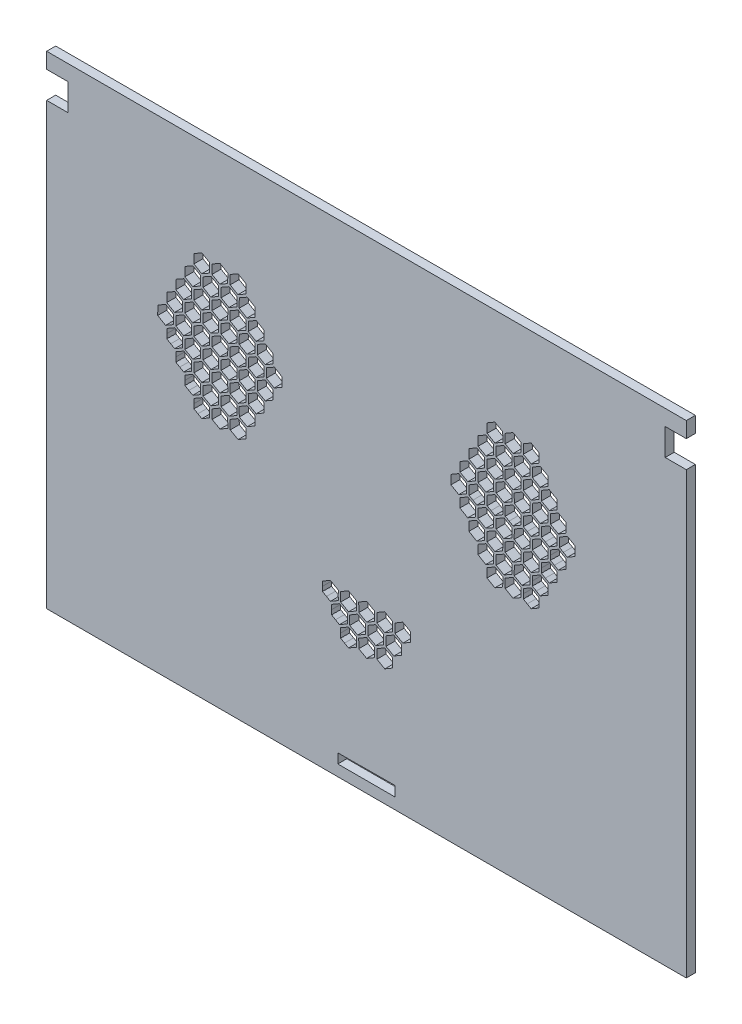
from build123d import *

# Parameters (mm, degrees)
BOSS_EXTRUDE1_DEPTH = 3


with BuildPart() as part:
    # Sketch1 → Boss-Extrude1 (new body)
    with BuildSketch(Plane.XY):
        Polygon((106, 80), (-106, 80), (-106, 74.8), (-99, 74.8), (-99, 65.9), (-106, 65.9), (-106, -80), (106, -80), (106, 65.9), (99, 65.9), (99, 74.8), (106, 74.8), align=None)
        Polygon((-3.358406193, -38.245892144), (-3.346192794, -39.72437967), (-3.370738906, -39.738823029), (-3.370974165, -39.767302264), (-4.657488621, -40.495968913), (-5.931789678, -41.24578979), (-5.956571049, -41.231753913), (-5.981352421, -41.24578979), (-7.255653477, -40.495968913), (-8.542167934, -39.767302264), (-8.542403193, -39.738823029), (-8.566949305, -39.72437967), (-8.554735905, -38.245892144), (-8.566949305, -36.767404619), (-8.542403193, -36.75296126), (-8.542167934, -36.724482025), (-7.255653477, -35.995815376), (-5.981352421, -35.245994499), (-5.956571049, -35.260030376), (-5.931789678, -35.245994499), (-4.657488621, -35.995815376), (-3.370974165, -36.724482025), (-3.370738906, -36.75296126), (-3.346192794, -36.767404619), align=None, mode=Mode.SUBTRACT)
        Polygon((-6.358406193, -33.049739722), (-6.346192794, -34.528227247), (-6.370738906, -34.542670606), (-6.370974165, -34.571149841), (-7.657488621, -35.29981649), (-8.931789678, -36.049637367), (-8.956571049, -36.03560149), (-8.981352421, -36.049637367), (-10.255653477, -35.29981649), (-11.542167934, -34.571149841), (-11.542403193, -34.542670606), (-11.566949305, -34.528227247), (-11.554735905, -33.049739722), (-11.566949305, -31.571252196), (-11.542403193, -31.556808837), (-11.542167934, -31.528329602), (-10.255653477, -30.799662953), (-8.981352421, -30.049842076), (-8.956571049, -30.063877953), (-8.931789678, -30.049842076), (-7.657488621, -30.799662953), (-6.370974165, -31.528329602), (-6.370738906, -31.556808837), (-6.346192794, -31.571252196), align=None, mode=Mode.SUBTRACT)
        Polygon((-2.981352421, -30.049842076), (-0.370974165, -31.528329602), (-0.346192794, -34.528227247), (-2.931789678, -36.049637367), (-5.542167934, -34.571149841), (-5.566949305, -31.571252196), align=None, mode=Mode.SUBTRACT)
        Polygon((-9.358406193, -27.853587299), (-9.346192794, -29.332074825), (-9.370738906, -29.346518183), (-9.370974165, -29.374997419), (-10.657488621, -30.103664067), (-11.931789678, -30.853484944), (-11.956571049, -30.839449067), (-11.981352421, -30.853484944), (-13.255653477, -30.103664067), (-14.542167934, -29.374997419), (-14.542403193, -29.346518183), (-14.566949305, -29.332074825), (-14.554735905, -27.853587299), (-14.566949305, -26.375099773), (-14.542403193, -26.360656415), (-14.542167934, -26.332177179), (-13.255653477, -25.60351053), (-11.981352421, -24.853689653), (-11.956571049, -24.86772553), (-11.931789678, -24.853689653), (-10.657488621, -25.60351053), (-9.370974165, -26.332177179), (-9.370738906, -26.360656415), (-9.346192794, -26.375099773), align=None, mode=Mode.SUBTRACT)
        Polygon((-3.346192794, -29.332074825), (-5.931789678, -30.853484944), (-8.542167934, -29.374997419), (-8.566949305, -26.375099773), (-5.981352421, -24.853689653), (-3.370974165, -26.332177179), align=None, mode=Mode.SUBTRACT)
        Polygon((-9.5, -73.116618176), (9.5, -73), (9.5, -76.316618176), (-9.5, -76.316618176), align=None, mode=Mode.SUBTRACT)
        Polygon((-2.566949305, -36.767404619), (0, -35.256967058), (0.018647579, -35.245994499), (2.629025835, -36.724482025), (2.653807206, -39.72437967), (0.068210322, -41.24578979), (0, -41.207156266), (-2.542167934, -39.767302264), align=None, mode=Mode.SUBTRACT)
        Polygon((6.018647579, -35.245994499), (8.629025835, -36.724482025), (8.653807206, -39.72437967), (6.068210322, -41.24578979), (3.457832066, -39.767302264), (3.433050695, -36.767404619), align=None, mode=Mode.SUBTRACT)
        Polygon((3.018647579, -30.049842076), (5.629025835, -31.528329602), (5.653807206, -34.528227247), (3.068210322, -36.049637367), (0.457832066, -34.571149841), (0.433050695, -31.571252196), align=None, mode=Mode.SUBTRACT)
        Polygon((9.018647579, -30.049842076), (11.629025835, -31.528329602), (11.653807206, -34.528227247), (9.068210322, -36.049637367), (6.457832066, -34.571149841), (6.433050695, -31.571252196), align=None, mode=Mode.SUBTRACT)
        Polygon((0.068210322, -30.853484944), (0, -30.814851421), (-2.542167934, -29.374997419), (-2.566949305, -26.375099773), (0, -24.864662213), (0.018647579, -24.853689653), (2.629025835, -26.332177179), (2.653807206, -29.332074825), align=None, mode=Mode.SUBTRACT)
        Polygon((8.653807206, -29.332074825), (6.068210322, -30.853484944), (3.457832066, -29.374997419), (3.433050695, -26.375099773), (6.018647579, -24.853689653), (8.629025835, -26.332177179), align=None, mode=Mode.SUBTRACT)
        Polygon((14.653807206, -29.332074825), (12.068210322, -30.853484944), (9.457832066, -29.374997419), (9.433050695, -26.375099773), (12.018647579, -24.853689653), (14.629025835, -26.332177179), align=None, mode=Mode.SUBTRACT)
        Polygon((-51.974746469, 3.264817356), (-51.962533069, 1.78632983), (-51.987079181, 1.771886472), (-51.987314441, 1.743407236), (-53.273828897, 1.014740588), (-54.548129954, 0.264919711), (-54.572911325, 0.278955588), (-54.597692696, 0.264919711), (-55.871993753, 1.014740588), (-57.158508209, 1.743407236), (-57.158743468, 1.771886472), (-57.18328958, 1.78632983), (-57.171076181, 3.264817356), (-57.18328958, 4.743304882), (-57.158743468, 4.75774824), (-57.158508209, 4.786227476), (-55.871993753, 5.514894125), (-54.597692696, 6.264715002), (-54.572911325, 6.250679125), (-54.548129954, 6.264715002), (-53.273828897, 5.514894125), (-51.987314441, 4.786227476), (-51.987079181, 4.75774824), (-51.962533069, 4.743304882), align=None, mode=Mode.SUBTRACT)
        Polygon((-54.974746469, 8.460969779), (-54.962533069, 6.982482253), (-54.987079181, 6.968038895), (-54.987314441, 6.939559659), (-56.273828897, 6.21089301), (-57.548129954, 5.461072133), (-57.572911325, 5.47510801), (-57.597692696, 5.461072133), (-58.871993753, 6.21089301), (-60.158508209, 6.939559659), (-60.158743468, 6.968038895), (-60.18328958, 6.982482253), (-60.171076181, 8.460969779), (-60.18328958, 9.939457305), (-60.158743468, 9.953900663), (-60.158508209, 9.982379899), (-58.871993753, 10.711046547), (-57.597692696, 11.460867424), (-57.572911325, 11.446831547), (-57.548129954, 11.460867424), (-56.273828897, 10.711046547), (-54.987314441, 9.982379899), (-54.987079181, 9.953900663), (-54.962533069, 9.939457305), align=None, mode=Mode.SUBTRACT)
        Polygon((-57.974746469, 13.657122201), (-57.962533069, 12.178634676), (-57.987079181, 12.164191317), (-57.987314441, 12.135712082), (-59.273828897, 11.407045433), (-60.548129954, 10.657224556), (-60.572911325, 10.671260433), (-60.597692696, 10.657224556), (-61.871993753, 11.407045433), (-63.158508209, 12.135712082), (-63.158743468, 12.164191317), (-63.18328958, 12.178634676), (-63.171076181, 13.657122201), (-63.18328958, 15.135609727), (-63.158743468, 15.150053086), (-63.158508209, 15.178532321), (-61.871993753, 15.90719897), (-60.597692696, 16.657019847), (-60.572911325, 16.64298397), (-60.548129954, 16.657019847), (-59.273828897, 15.90719897), (-57.987314441, 15.178532321), (-57.987079181, 15.150053086), (-57.962533069, 15.135609727), align=None, mode=Mode.SUBTRACT)
        Polygon((-51.962533069, 12.178634676), (-54.548129954, 10.657224556), (-57.158508209, 12.135712082), (-57.18328958, 15.135609727), (-54.597692696, 16.657019847), (-51.987314441, 15.178532321), align=None, mode=Mode.SUBTRACT)
        Polygon((-48.597692696, 6.264715002), (-45.987314441, 4.786227476), (-45.962533069, 1.78632983), (-48.548129954, 0.264919711), (-51.158508209, 1.743407236), (-51.18328958, 4.743304882), align=None, mode=Mode.SUBTRACT)
        Polygon((-51.597692696, 11.460867424), (-48.987314441, 9.982379899), (-48.962533069, 6.982482253), (-51.548129954, 5.461072133), (-54.158508209, 6.939559659), (-54.18328958, 9.939457305), align=None, mode=Mode.SUBTRACT)
        Polygon((-45.597692696, 11.460867424), (-42.987314441, 9.982379899), (-42.962533069, 6.982482253), (-45.548129954, 5.461072133), (-48.158508209, 6.939559659), (-48.18328958, 9.939457305), align=None, mode=Mode.SUBTRACT)
        Polygon((-42.597692696, 6.264715002), (-39.987314441, 4.786227476), (-39.962533069, 1.78632983), (-42.548129954, 0.264919711), (-45.158508209, 1.743407236), (-45.18328958, 4.743304882), align=None, mode=Mode.SUBTRACT)
        Polygon((-39.597692696, 11.460867424), (-36.987314441, 9.982379899), (-36.962533069, 6.982482253), (-39.548129954, 5.461072133), (-42.158508209, 6.939559659), (-42.18328958, 9.939457305), align=None, mode=Mode.SUBTRACT)
        Polygon((-45.962533069, 12.178634676), (-48.548129954, 10.657224556), (-51.158508209, 12.135712082), (-51.18328958, 15.135609727), (-48.597692696, 16.657019847), (-45.987314441, 15.178532321), align=None, mode=Mode.SUBTRACT)
        Polygon((-39.962533069, 12.178634676), (-42.548129954, 10.657224556), (-45.158508209, 12.135712082), (-45.18328958, 15.135609727), (-42.597692696, 16.657019847), (-39.987314441, 15.178532321), align=None, mode=Mode.SUBTRACT)
        Polygon((-33.962533069, 12.178634676), (-36.548129954, 10.657224556), (-39.158508209, 12.135712082), (-39.18328958, 15.135609727), (-36.597692696, 16.657019847), (-33.987314441, 15.178532321), align=None, mode=Mode.SUBTRACT)
        Polygon((-60.974746469, 18.853274624), (-60.962533069, 17.374787098), (-60.987079181, 17.36034374), (-60.987314441, 17.331864504), (-62.273828897, 16.603197856), (-63.548129954, 15.853376979), (-63.572911325, 15.867412856), (-63.597692696, 15.853376979), (-64.871993753, 16.603197856), (-66.158508209, 17.331864504), (-66.158743468, 17.36034374), (-66.18328958, 17.374787098), (-66.171076181, 18.853274624), (-66.18328958, 20.33176215), (-66.158743468, 20.346205508), (-66.158508209, 20.374684744), (-64.871993753, 21.103351393), (-63.597692696, 21.85317227), (-63.572911325, 21.839136393), (-63.548129954, 21.85317227), (-62.273828897, 21.103351393), (-60.987314441, 20.374684744), (-60.987079181, 20.346205508), (-60.962533069, 20.33176215), align=None, mode=Mode.SUBTRACT)
        Polygon((-66.597692696, 21.049529401), (-67.871993753, 21.799350278), (-69.18328958, 22.570939521), (-69.158508209, 25.570837167), (-66.548129954, 27.049324692), (-63.962533069, 25.527914573), (-63.987079181, 22.556496163), (-63.987314441, 22.528016927), (-65.273828897, 21.799350278), (-66.548129954, 21.049529401), (-66.572911325, 21.063565278), align=None, mode=Mode.SUBTRACT)
        Polygon((-59.273828897, 21.799350278), (-60.548129954, 21.049529401), (-60.572911325, 21.063565278), (-60.597692696, 21.049529401), (-61.871993753, 21.799350278), (-63.18328958, 22.570939521), (-63.158508209, 25.570837167), (-60.548129954, 27.049324692), (-57.962533069, 25.527914573), (-57.987079181, 22.556496163), (-57.987314441, 22.528016927), align=None, mode=Mode.SUBTRACT)
        Polygon((-60.18328958, 20.33176215), (-57.597692696, 21.85317227), (-54.987314441, 20.374684744), (-54.962533069, 17.374787098), (-57.548129954, 15.853376979), (-60.158508209, 17.331864504), align=None, mode=Mode.SUBTRACT)
        Polygon((-53.273828897, 21.799350278), (-54.548129954, 21.049529401), (-54.572911325, 21.063565278), (-54.597692696, 21.049529401), (-55.871993753, 21.799350278), (-57.18328958, 22.570939521), (-57.158508209, 25.570837167), (-54.548129954, 27.049324692), (-51.962533069, 25.527914573), (-51.987079181, 22.556496163), (-51.987314441, 22.528016927), align=None, mode=Mode.SUBTRACT)
        Polygon((-60.962533069, 30.724066995), (-60.987314441, 27.72416935), (-63.597692696, 26.245681824), (-66.18328958, 27.767091944), (-66.158508209, 30.766989589), (-63.548129954, 32.245477115), align=None, mode=Mode.SUBTRACT)
        Polygon((-57.597692696, 26.245681824), (-60.18328958, 27.767091944), (-60.158508209, 30.766989589), (-57.548129954, 32.245477115), (-54.962533069, 30.724066995), (-54.987314441, 27.72416935), align=None, mode=Mode.SUBTRACT)
        Polygon((-54.18328958, 20.33176215), (-51.597692696, 21.85317227), (-48.987314441, 20.374684744), (-48.962533069, 17.374787098), (-51.548129954, 15.853376979), (-54.158508209, 17.331864504), align=None, mode=Mode.SUBTRACT)
        Polygon((-48.18328958, 20.33176215), (-45.597692696, 21.85317227), (-42.987314441, 20.374684744), (-42.962533069, 17.374787098), (-45.548129954, 15.853376979), (-48.158508209, 17.331864504), align=None, mode=Mode.SUBTRACT)
        Polygon((-45.962533069, 25.527914573), (-45.974746469, 24.049427047), (-45.987079181, 22.556496163), (-45.987314441, 22.528016927), (-47.273828897, 21.799350278), (-48.548129954, 21.049529401), (-48.572911325, 21.063565278), (-48.597692696, 21.049529401), (-49.871993753, 21.799350278), (-51.18328958, 22.570939521), (-51.158508209, 25.570837167), (-48.548129954, 27.049324692), align=None, mode=Mode.SUBTRACT)
        Polygon((-42.18328958, 20.33176215), (-39.597692696, 21.85317227), (-36.987314441, 20.374684744), (-36.962533069, 17.374787098), (-39.548129954, 15.853376979), (-42.158508209, 17.331864504), align=None, mode=Mode.SUBTRACT)
        Polygon((-39.962533069, 25.527914573), (-39.974746469, 24.049427047), (-39.987079181, 22.556496163), (-39.987314441, 22.528016927), (-41.273828897, 21.799350278), (-42.548129954, 21.049529401), (-42.572911325, 21.063565278), (-42.597692696, 21.049529401), (-43.871993753, 21.799350278), (-45.18328958, 22.570939521), (-45.171076181, 24.049427047), (-45.158508209, 25.570837167), (-42.548129954, 27.049324692), align=None, mode=Mode.SUBTRACT)
        Polygon((-33.962533069, 25.527914573), (-33.974746469, 24.049427047), (-33.987079181, 22.556496163), (-33.987314441, 22.528016927), (-35.273828897, 21.799350278), (-36.548129954, 21.049529401), (-36.572911325, 21.063565278), (-36.597692696, 21.049529401), (-37.871993753, 21.799350278), (-39.18328958, 22.570939521), (-39.171076181, 24.049427047), (-39.158508209, 25.570837167), (-36.548129954, 27.049324692), align=None, mode=Mode.SUBTRACT)
        Polygon((-51.597692696, 26.245681824), (-54.18328958, 27.767091944), (-54.158508209, 30.766989589), (-51.548129954, 32.245477115), (-48.962533069, 30.724066995), (-48.987314441, 27.72416935), align=None, mode=Mode.SUBTRACT)
        Polygon((-45.597692696, 26.245681824), (-48.18328958, 27.767091944), (-48.158508209, 30.766989589), (-45.548129954, 32.245477115), (-42.962533069, 30.724066995), (-42.987314441, 27.72416935), align=None, mode=Mode.SUBTRACT)
        Polygon((-39.597692696, 26.245681824), (-42.18328958, 27.767091944), (-42.158508209, 30.766989589), (-39.548129954, 32.245477115), (-36.962533069, 30.724066995), (-36.987314441, 27.72416935), align=None, mode=Mode.SUBTRACT)
        Polygon((-57.962533069, 35.920219418), (-57.987314441, 32.920321773), (-60.597692696, 31.441834247), (-63.18328958, 32.963244367), (-63.158508209, 35.963142012), (-60.548129954, 37.441629538), align=None, mode=Mode.SUBTRACT)
        Polygon((-57.18328958, 32.963244367), (-57.158508209, 35.963142012), (-54.548129954, 37.441629538), (-51.962533069, 35.920219418), (-51.987314441, 32.920321773), (-54.597692696, 31.441834247), align=None, mode=Mode.SUBTRACT)
        Polygon((-54.962533069, 41.116371841), (-54.987314441, 38.116474195), (-57.597692696, 36.637986669), (-60.18328958, 38.159396789), (-60.158508209, 41.159294435), (-57.548129954, 42.637781961), align=None, mode=Mode.SUBTRACT)
        Polygon((-51.962533069, 46.312524264), (-51.987314441, 43.312626618), (-54.597692696, 41.834139092), (-57.18328958, 43.355549212), (-57.158508209, 46.355446857), (-54.548129954, 47.833934383), align=None, mode=Mode.SUBTRACT)
        Polygon((-51.18328958, 32.963244367), (-51.158508209, 35.963142012), (-48.548129954, 37.441629538), (-45.962533069, 35.920219418), (-45.987314441, 32.920321773), (-48.597692696, 31.441834247), align=None, mode=Mode.SUBTRACT)
        Polygon((-48.987314441, 38.116474195), (-51.597692696, 36.637986669), (-54.18328958, 38.159396789), (-54.158508209, 41.159294435), (-51.548129954, 42.637781961), (-48.962533069, 41.116371841), align=None, mode=Mode.SUBTRACT)
        Polygon((-42.987314441, 38.116474195), (-45.597692696, 36.637986669), (-48.18328958, 38.159396789), (-48.158508209, 41.159294435), (-45.548129954, 42.637781961), (-42.962533069, 41.116371841), align=None, mode=Mode.SUBTRACT)
        Polygon((-45.18328958, 32.963244367), (-45.158508209, 35.963142012), (-42.548129954, 37.441629538), (-39.962533069, 35.920219418), (-39.987314441, 32.920321773), (-42.597692696, 31.441834247), align=None, mode=Mode.SUBTRACT)
        Polygon((-39.18328958, 32.963244367), (-39.158508209, 35.963142012), (-36.548129954, 37.441629538), (-33.962533069, 35.920219418), (-33.987314441, 32.920321773), (-36.597692696, 31.441834247), align=None, mode=Mode.SUBTRACT)
        Polygon((-36.987314441, 38.116474195), (-39.597692696, 36.637986669), (-42.18328958, 38.159396789), (-42.158508209, 41.159294435), (-39.548129954, 42.637781961), (-36.962533069, 41.116371841), align=None, mode=Mode.SUBTRACT)
        Polygon((-45.987314441, 43.312626618), (-48.597692696, 41.834139092), (-51.18328958, 43.355549212), (-51.158508209, 46.355446857), (-48.548129954, 47.833934383), (-45.962533069, 46.312524264), align=None, mode=Mode.SUBTRACT)
        Polygon((-39.987314441, 43.312626618), (-42.597692696, 41.834139092), (-45.18328958, 43.355549212), (-45.158508209, 46.355446857), (-42.548129954, 47.833934383), (-39.962533069, 46.312524264), align=None, mode=Mode.SUBTRACT)
        Polygon((-36.18328958, 20.33176215), (-33.597692696, 21.85317227), (-30.987314441, 20.374684744), (-30.962533069, 17.374787098), (-33.548129954, 15.853376979), (-36.158508209, 17.331864504), align=None, mode=Mode.SUBTRACT)
        Polygon((-27.962533069, 25.527914573), (-27.974746469, 24.049427047), (-27.987314441, 22.528016927), (-30.572911325, 21.063565278), (-30.597692696, 21.049529401), (-31.871993753, 21.799350278), (-33.18328958, 22.570939521), (-33.171076181, 24.049427047), (-33.158508209, 25.570837167), (-30.548129954, 27.049324692), align=None, mode=Mode.SUBTRACT)
        Polygon((-33.597692696, 26.245681824), (-36.18328958, 27.767091944), (-36.158508209, 30.766989589), (-33.548129954, 32.245477115), (-30.962533069, 30.724066995), (-30.987314441, 27.72416935), align=None, mode=Mode.SUBTRACT)
        Polygon((39.987314441, 4.786227476), (42.597692696, 6.264715002), (45.18328958, 4.743304882), (45.158508209, 1.743407236), (42.548129954, 0.264919711), (39.962533069, 1.78632983), align=None, mode=Mode.SUBTRACT)
        Polygon((36.987314441, 9.982379899), (39.597692696, 11.460867424), (42.18328958, 9.939457305), (42.158508209, 6.939559659), (39.548129954, 5.461072133), (36.962533069, 6.982482253), align=None, mode=Mode.SUBTRACT)
        Polygon((45.987314441, 4.786227476), (48.597692696, 6.264715002), (51.18328958, 4.743304882), (51.158508209, 1.743407236), (48.548129954, 0.264919711), (45.962533069, 1.78632983), align=None, mode=Mode.SUBTRACT)
        Polygon((42.987314441, 9.982379899), (45.597692696, 11.460867424), (48.18328958, 9.939457305), (48.158508209, 6.939559659), (45.548129954, 5.461072133), (42.962533069, 6.982482253), align=None, mode=Mode.SUBTRACT)
        Polygon((48.987314441, 9.982379899), (51.597692696, 11.460867424), (54.18328958, 9.939457305), (54.158508209, 6.939559659), (51.548129954, 5.461072133), (48.962533069, 6.982482253), align=None, mode=Mode.SUBTRACT)
        Polygon((39.18328958, 15.135609727), (39.158508209, 12.135712082), (36.548129954, 10.657224556), (33.962533069, 12.178634676), (33.987314441, 15.178532321), (36.597692696, 16.657019847), align=None, mode=Mode.SUBTRACT)
        Polygon((45.18328958, 15.135609727), (45.158508209, 12.135712082), (42.548129954, 10.657224556), (39.962533069, 12.178634676), (39.987314441, 15.178532321), (42.597692696, 16.657019847), align=None, mode=Mode.SUBTRACT)
        Polygon((51.18328958, 15.135609727), (51.158508209, 12.135712082), (48.548129954, 10.657224556), (45.962533069, 12.178634676), (45.987314441, 15.178532321), (48.597692696, 16.657019847), align=None, mode=Mode.SUBTRACT)
        Polygon((51.974746469, 3.264817356), (51.962533069, 4.743304882), (51.987079181, 4.75774824), (51.987314441, 4.786227476), (53.273828897, 5.514894125), (54.548129954, 6.264715002), (54.572911325, 6.250679125), (54.597692696, 6.264715002), (55.871993753, 5.514894125), (57.158508209, 4.786227476), (57.158743468, 4.75774824), (57.18328958, 4.743304882), (57.171076181, 3.264817356), (57.18328958, 1.78632983), (57.158743468, 1.771886472), (57.158508209, 1.743407236), (55.871993753, 1.014740588), (54.597692696, 0.264919711), (54.572911325, 0.278955588), (54.548129954, 0.264919711), (53.273828897, 1.014740588), (51.987314441, 1.743407236), (51.987079181, 1.771886472), (51.962533069, 1.78632983), align=None, mode=Mode.SUBTRACT)
        Polygon((54.974746469, 8.460969779), (54.962533069, 9.939457305), (54.987079181, 9.953900663), (54.987314441, 9.982379899), (56.273828897, 10.711046547), (57.548129954, 11.460867424), (57.572911325, 11.446831547), (57.597692696, 11.460867424), (58.871993753, 10.711046547), (60.158508209, 9.982379899), (60.158743468, 9.953900663), (60.18328958, 9.939457305), (60.171076181, 8.460969779), (60.18328958, 6.982482253), (60.158743468, 6.968038895), (60.158508209, 6.939559659), (58.871993753, 6.21089301), (57.597692696, 5.461072133), (57.572911325, 5.47510801), (57.548129954, 5.461072133), (56.273828897, 6.21089301), (54.987314441, 6.939559659), (54.987079181, 6.968038895), (54.962533069, 6.982482253), align=None, mode=Mode.SUBTRACT)
        Polygon((57.18328958, 15.135609727), (57.158508209, 12.135712082), (54.548129954, 10.657224556), (51.962533069, 12.178634676), (51.987314441, 15.178532321), (54.597692696, 16.657019847), align=None, mode=Mode.SUBTRACT)
        Polygon((57.974746469, 13.657122201), (57.962533069, 15.135609727), (57.987079181, 15.150053086), (57.987314441, 15.178532321), (59.273828897, 15.90719897), (60.548129954, 16.657019847), (60.572911325, 16.64298397), (60.597692696, 16.657019847), (61.871993753, 15.90719897), (63.158508209, 15.178532321), (63.158743468, 15.150053086), (63.18328958, 15.135609727), (63.171076181, 13.657122201), (63.18328958, 12.178634676), (63.158743468, 12.164191317), (63.158508209, 12.135712082), (61.871993753, 11.407045433), (60.597692696, 10.657224556), (60.572911325, 10.671260433), (60.548129954, 10.657224556), (59.273828897, 11.407045433), (57.987314441, 12.135712082), (57.987079181, 12.164191317), (57.962533069, 12.178634676), align=None, mode=Mode.SUBTRACT)
        Polygon((33.597692696, 21.85317227), (36.18328958, 20.33176215), (36.158508209, 17.331864504), (33.548129954, 15.853376979), (30.962533069, 17.374787098), (30.987314441, 20.374684744), align=None, mode=Mode.SUBTRACT)
        Polygon((27.987314441, 22.528016927), (27.974746469, 24.049427047), (27.962533069, 25.527914573), (30.548129954, 27.049324692), (33.158508209, 25.570837167), (33.171076181, 24.049427047), (33.18328958, 22.570939521), (31.871993753, 21.799350278), (30.597692696, 21.049529401), (30.572911325, 21.063565278), align=None, mode=Mode.SUBTRACT)
        Polygon((36.18328958, 27.767091944), (33.597692696, 26.245681824), (30.987314441, 27.72416935), (30.962533069, 30.724066995), (33.548129954, 32.245477115), (36.158508209, 30.766989589), align=None, mode=Mode.SUBTRACT)
        Polygon((39.597692696, 21.85317227), (42.18328958, 20.33176215), (42.158508209, 17.331864504), (39.548129954, 15.853376979), (36.962533069, 17.374787098), (36.987314441, 20.374684744), align=None, mode=Mode.SUBTRACT)
        Polygon((33.987079181, 22.556496163), (33.974746469, 24.049427047), (33.962533069, 25.527914573), (36.548129954, 27.049324692), (39.158508209, 25.570837167), (39.171076181, 24.049427047), (39.18328958, 22.570939521), (37.871993753, 21.799350278), (36.597692696, 21.049529401), (36.572911325, 21.063565278), (36.548129954, 21.049529401), (35.273828897, 21.799350278), (33.987314441, 22.528016927), align=None, mode=Mode.SUBTRACT)
        Polygon((39.987079181, 22.556496163), (39.974746469, 24.049427047), (39.962533069, 25.527914573), (42.548129954, 27.049324692), (45.158508209, 25.570837167), (45.171076181, 24.049427047), (45.18328958, 22.570939521), (43.871993753, 21.799350278), (42.597692696, 21.049529401), (42.572911325, 21.063565278), (42.548129954, 21.049529401), (41.273828897, 21.799350278), (39.987314441, 22.528016927), align=None, mode=Mode.SUBTRACT)
        Polygon((45.597692696, 21.85317227), (48.18328958, 20.33176215), (48.158508209, 17.331864504), (45.548129954, 15.853376979), (42.962533069, 17.374787098), (42.987314441, 20.374684744), align=None, mode=Mode.SUBTRACT)
        Polygon((51.597692696, 21.85317227), (54.18328958, 20.33176215), (54.158508209, 17.331864504), (51.548129954, 15.853376979), (48.962533069, 17.374787098), (48.987314441, 20.374684744), align=None, mode=Mode.SUBTRACT)
        Polygon((45.987079181, 22.556496163), (45.974746469, 24.049427047), (45.962533069, 25.527914573), (48.548129954, 27.049324692), (51.158508209, 25.570837167), (51.18328958, 22.570939521), (49.871993753, 21.799350278), (48.597692696, 21.049529401), (48.572911325, 21.063565278), (48.548129954, 21.049529401), (47.273828897, 21.799350278), (45.987314441, 22.528016927), align=None, mode=Mode.SUBTRACT)
        Polygon((42.18328958, 27.767091944), (39.597692696, 26.245681824), (36.987314441, 27.72416935), (36.962533069, 30.724066995), (39.548129954, 32.245477115), (42.158508209, 30.766989589), align=None, mode=Mode.SUBTRACT)
        Polygon((48.18328958, 27.767091944), (45.597692696, 26.245681824), (42.987314441, 27.72416935), (42.962533069, 30.724066995), (45.548129954, 32.245477115), (48.158508209, 30.766989589), align=None, mode=Mode.SUBTRACT)
        Polygon((54.18328958, 27.767091944), (51.597692696, 26.245681824), (48.987314441, 27.72416935), (48.962533069, 30.724066995), (51.548129954, 32.245477115), (54.158508209, 30.766989589), align=None, mode=Mode.SUBTRACT)
        Polygon((57.597692696, 21.85317227), (60.18328958, 20.33176215), (60.158508209, 17.331864504), (57.548129954, 15.853376979), (54.962533069, 17.374787098), (54.987314441, 20.374684744), align=None, mode=Mode.SUBTRACT)
        Polygon((51.987079181, 22.556496163), (51.962533069, 25.527914573), (54.548129954, 27.049324692), (57.158508209, 25.570837167), (57.18328958, 22.570939521), (55.871993753, 21.799350278), (54.597692696, 21.049529401), (54.572911325, 21.063565278), (54.548129954, 21.049529401), (53.273828897, 21.799350278), (51.987314441, 22.528016927), align=None, mode=Mode.SUBTRACT)
        Polygon((60.974746469, 18.853274624), (60.962533069, 20.33176215), (60.987079181, 20.346205508), (60.987314441, 20.374684744), (62.273828897, 21.103351393), (63.548129954, 21.85317227), (63.572911325, 21.839136393), (63.597692696, 21.85317227), (64.871993753, 21.103351393), (66.158508209, 20.374684744), (66.158743468, 20.346205508), (66.18328958, 20.33176215), (66.171076181, 18.853274624), (66.18328958, 17.374787098), (66.158743468, 17.36034374), (66.158508209, 17.331864504), (64.871993753, 16.603197856), (63.597692696, 15.853376979), (63.572911325, 15.867412856), (63.548129954, 15.853376979), (62.273828897, 16.603197856), (60.987314441, 17.331864504), (60.987079181, 17.36034374), (60.962533069, 17.374787098), align=None, mode=Mode.SUBTRACT)
        Polygon((57.987079181, 22.556496163), (57.962533069, 25.527914573), (60.548129954, 27.049324692), (63.158508209, 25.570837167), (63.18328958, 22.570939521), (61.871993753, 21.799350278), (60.597692696, 21.049529401), (60.572911325, 21.063565278), (60.548129954, 21.049529401), (59.273828897, 21.799350278), (57.987314441, 22.528016927), align=None, mode=Mode.SUBTRACT)
        Polygon((66.548129954, 27.049324692), (69.158508209, 25.570837167), (69.18328958, 22.570939521), (67.871993753, 21.799350278), (66.597692696, 21.049529401), (66.572911325, 21.063565278), (66.548129954, 21.049529401), (65.273828897, 21.799350278), (63.987314441, 22.528016927), (63.987079181, 22.556496163), (63.962533069, 25.527914573), align=None, mode=Mode.SUBTRACT)
        Polygon((60.18328958, 27.767091944), (57.597692696, 26.245681824), (54.987314441, 27.72416935), (54.962533069, 30.724066995), (57.548129954, 32.245477115), (60.158508209, 30.766989589), align=None, mode=Mode.SUBTRACT)
        Polygon((60.987314441, 27.72416935), (60.962533069, 30.724066995), (63.548129954, 32.245477115), (66.158508209, 30.766989589), (66.18328958, 27.767091944), (63.597692696, 26.245681824), align=None, mode=Mode.SUBTRACT)
        Polygon((33.962533069, 35.920219418), (36.548129954, 37.441629538), (39.158508209, 35.963142012), (39.18328958, 32.963244367), (36.597692696, 31.441834247), (33.987314441, 32.920321773), align=None, mode=Mode.SUBTRACT)
        Polygon((39.962533069, 35.920219418), (42.548129954, 37.441629538), (45.158508209, 35.963142012), (45.18328958, 32.963244367), (42.597692696, 31.441834247), (39.987314441, 32.920321773), align=None, mode=Mode.SUBTRACT)
        Polygon((39.597692696, 36.637986669), (36.987314441, 38.116474195), (36.962533069, 41.116371841), (39.548129954, 42.637781961), (42.158508209, 41.159294435), (42.18328958, 38.159396789), align=None, mode=Mode.SUBTRACT)
        Polygon((45.962533069, 35.920219418), (48.548129954, 37.441629538), (51.158508209, 35.963142012), (51.18328958, 32.963244367), (48.597692696, 31.441834247), (45.987314441, 32.920321773), align=None, mode=Mode.SUBTRACT)
        Polygon((45.597692696, 36.637986669), (42.987314441, 38.116474195), (42.962533069, 41.116371841), (45.548129954, 42.637781961), (48.158508209, 41.159294435), (48.18328958, 38.159396789), align=None, mode=Mode.SUBTRACT)
        Polygon((51.597692696, 36.637986669), (48.987314441, 38.116474195), (48.962533069, 41.116371841), (51.548129954, 42.637781961), (54.158508209, 41.159294435), (54.18328958, 38.159396789), align=None, mode=Mode.SUBTRACT)
        Polygon((42.597692696, 41.834139092), (39.987314441, 43.312626618), (39.962533069, 46.312524264), (42.548129954, 47.833934383), (45.158508209, 46.355446857), (45.18328958, 43.355549212), align=None, mode=Mode.SUBTRACT)
        Polygon((48.597692696, 41.834139092), (45.987314441, 43.312626618), (45.962533069, 46.312524264), (48.548129954, 47.833934383), (51.158508209, 46.355446857), (51.18328958, 43.355549212), align=None, mode=Mode.SUBTRACT)
        Polygon((51.962533069, 35.920219418), (54.548129954, 37.441629538), (57.158508209, 35.963142012), (57.18328958, 32.963244367), (54.597692696, 31.441834247), (51.987314441, 32.920321773), align=None, mode=Mode.SUBTRACT)
        Polygon((54.987314441, 38.116474195), (54.962533069, 41.116371841), (57.548129954, 42.637781961), (60.158508209, 41.159294435), (60.18328958, 38.159396789), (57.597692696, 36.637986669), align=None, mode=Mode.SUBTRACT)
        Polygon((57.987314441, 32.920321773), (57.962533069, 35.920219418), (60.548129954, 37.441629538), (63.158508209, 35.963142012), (63.18328958, 32.963244367), (60.597692696, 31.441834247), align=None, mode=Mode.SUBTRACT)
        Polygon((51.987314441, 43.312626618), (51.962533069, 46.312524264), (54.548129954, 47.833934383), (57.158508209, 46.355446857), (57.18328958, 43.355549212), (54.597692696, 41.834139092), align=None, mode=Mode.SUBTRACT)
    extrude(amount=BOSS_EXTRUDE1_DEPTH)


solid = part.part
